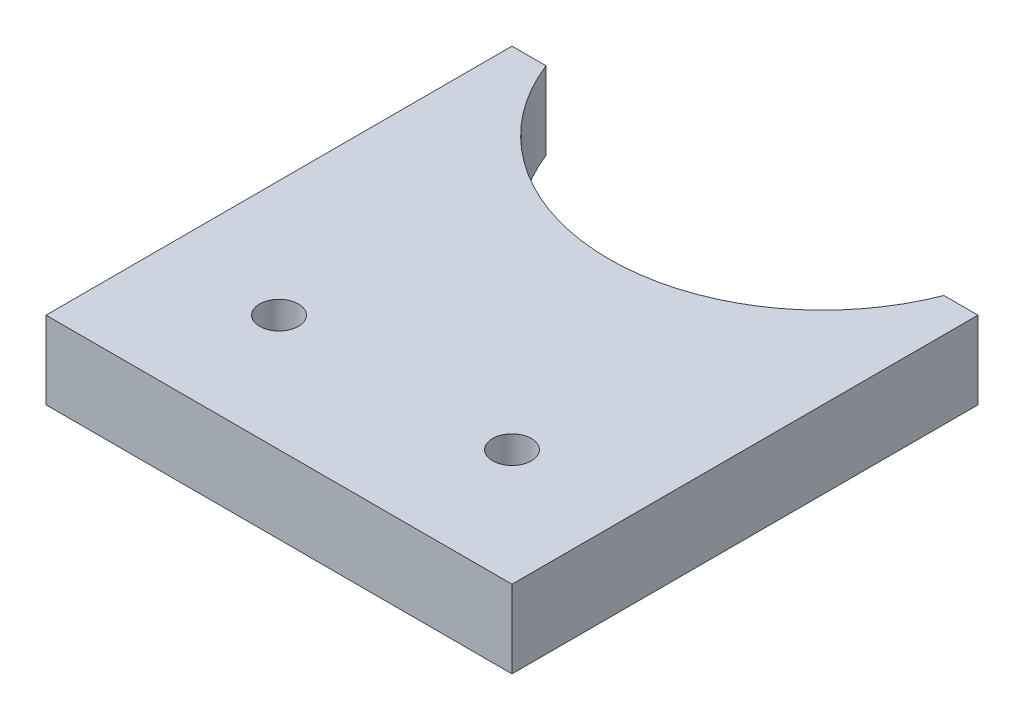
from build123d import *

# Parameters (mm, degrees)
BOSS_EXTRUDE1_DEPTH = 12.7
SKETCH2_R           = 3.175
CUT_EXTRUDE1_DEPTH  = 12.7


with BuildPart() as part:
    # Sketch1 → Boss-Extrude1 (new body)
    with BuildSketch(Plane(origin=(0, 0, 0), x_dir=(1, 0, 0), z_dir=(0, 1, 0))):
        with BuildLine():
            Line((38.1, 38.1), (32.534068682, 38.1))
            ThreePointArc((32.534068682, 38.1), (0, 15.875), (-32.534068682, 38.1))
            Line((-32.534068682, 38.1), (-38.1, 38.1))
            Line((-38.1, 38.1), (-38.1, -38.1))
            Line((-38.1, -38.1), (38.1, -38.1))
            Line((38.1, -38.1), (38.1, 38.1))
        make_face()
    extrude(amount=BOSS_EXTRUDE1_DEPTH)

    # Sketch2 → Cut-Extrude1 (cut)
    with BuildSketch(Plane(origin=(0, 12.7, 0), x_dir=(1, 0, 0), z_dir=(0, 1, 0))):
        with Locations((-19.05, -19.05)):
            Circle(SKETCH2_R)
        with Locations((19.05, -19.05)):
            Circle(SKETCH2_R)
    extrude(amount=-CUT_EXTRUDE1_DEPTH, mode=Mode.SUBTRACT)


solid = part.part
